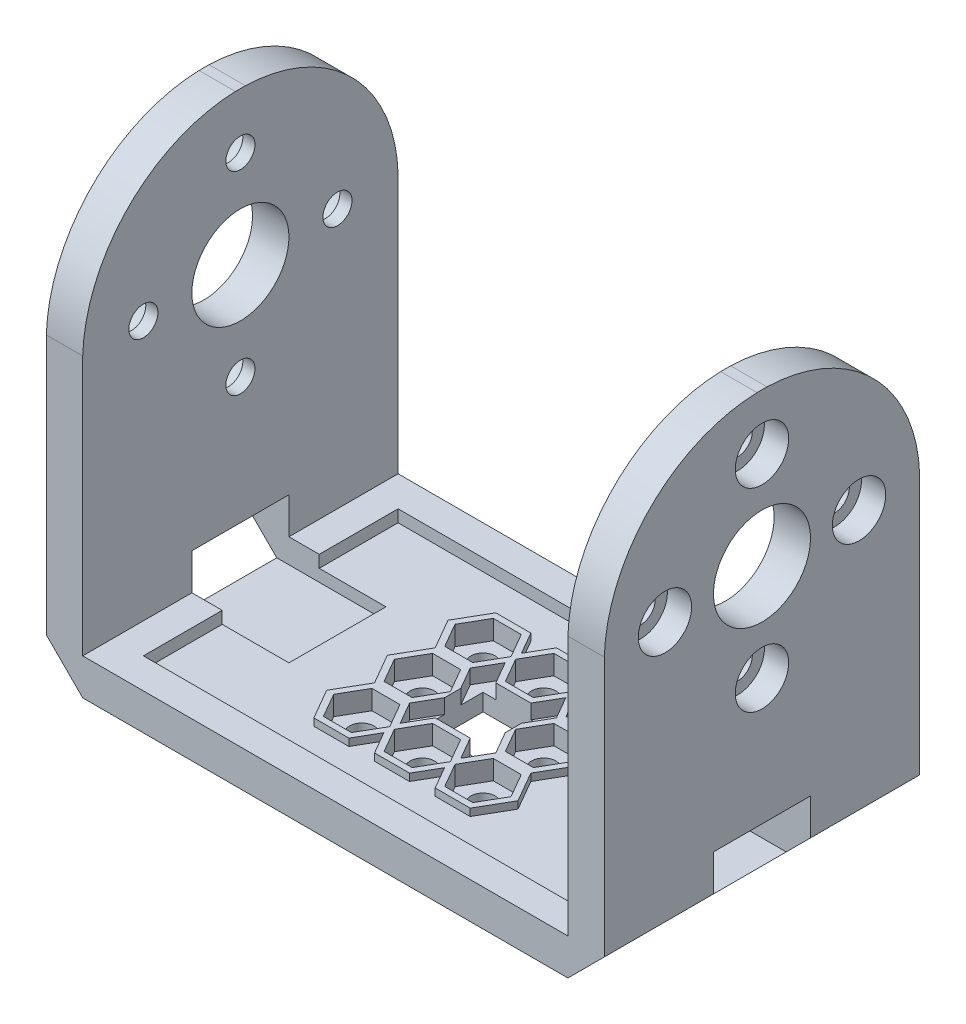
from build123d import *

# Parameters (mm, degrees)
SKETCH_1_W                   = 46
SKETCH_1_H                   = 26
EXTRUDE_1_DEPTH              = 3
SKETCH_2_W                   = 3
SKETCH_2_H                   = 26
EXTRUDE_2_DEPTH              = 34
CUT_EXTRUDE_START            = -46
CUT_EXTRUDE_1_DEPTH          = 46
SKETCH_4_R                   = 4
CUT_EXTRUDE_2_DEPTH          = 61.448325039
HOLE_START                   = -23
HOLE_WIZARD_M2_2_OUTLINE_R   = 2.2
HOLE_WIZARD_M2_2_DEPTH       = 2
HOLE_START_2                 = -21
HOLE_WIZARD_M2_2_2_OUTLINE_R = 1.2
HOLE_WIZARD_M2_2_2_DEPTH     = 1
SKETCH_9_W                   = 35
SKETCH_9_H                   = 21
CUT_EXTRUDE_3_DEPTH          = 1
CHAMFER_1_SIZE               = 3
EXTRUDE_2_2_DEPTH            = 0.6
CUT_EXTRUDE_START_2          = -1
CUT_EXTRUDE_4_DEPTH          = 1.6
SKETCH_11_R                  = 1
CUT_EXTRUDE_5_DEPTH          = 45.654227124
SKETCH_12_W                  = 5
SKETCH_12_H                  = 5
CUT_EXTRUDE_6_DEPTH          = 2.5
CUT_EXTRUDE_7_DEPTH          = 0.6
SKETCH_15_W                  = 8
SKETCH_15_H                  = 5
CUT_EXTRUDE_8_DEPTH          = 11


# Read off the part's stored shape, not the designer's step: 切除-拉伸1, M2 凹头盖螺钉的柱形沉头孔2
with BuildPart() as part:
    # 草图1 → 凸台-拉伸1 (new body)
    with BuildSketch(Plane(origin=(0, 0, 0), x_dir=(1, 0, 0), z_dir=(0, 1, 0))):
        Rectangle(SKETCH_1_W, SKETCH_1_H)
    extrude(amount=EXTRUDE_1_DEPTH)

    # 草图2 → Extrude 2 (add)
    with BuildSketch(Plane(origin=(0, 3, 0), x_dir=(1, 0, 0), z_dir=(0, 1, 0))):
        with Locations((-21.5, 0)):
            Rectangle(SKETCH_2_W, SKETCH_2_H)
        with Locations((21.5, 0)):
            Rectangle(SKETCH_2_W, SKETCH_2_H)
    extrude(amount=EXTRUDE_2_DEPTH)

    # 切除-拉伸1 outline → 切除-拉伸1 (cut)
    with BuildSketch(Plane.ZY.offset(23).offset(CUT_EXTRUDE_START)):
        with BuildLine():
            Line((13, 37), (0.412804961, 37))
            ThreePointArc((0.412804961, 37), (9.197021473, 33.197021473), (13, 24.412804961))
            Line((13, 24.412804961), (13, 37))
        make_face()
        with BuildLine():
            ThreePointArc((-13, 24.412804961), (-9.197021473, 33.197021473), (-0.412804961, 37))
            Line((-0.412804961, 37), (-13, 37))
            Line((-13, 37), (-13, 24.412804961))
        make_face()
    extrude(amount=CUT_EXTRUDE_1_DEPTH, mode=Mode.SUBTRACT)

    # 草图4 → 切除-拉伸2 (cut, through all)
    with BuildSketch(Plane.ZY.offset(23)):
        with Locations((0, 24.412804961)):
            Circle(SKETCH_4_R)
    extrude(amount=-CUT_EXTRUDE_2_DEPTH, mode=Mode.SUBTRACT)

    # M2 凹头盖螺钉的柱形沉头孔2 outline → M2 凹头盖螺钉的柱形沉头孔2 (cut)
    with BuildSketch(Plane.YZ.offset(HOLE_START)):
        with Locations((16.412804961, 0)):
            Circle(HOLE_WIZARD_M2_2_OUTLINE_R)
        with Locations((24.412804961, 8)):
            Circle(HOLE_WIZARD_M2_2_OUTLINE_R)
        with Locations((24.412804961, -8)):
            Circle(HOLE_WIZARD_M2_2_OUTLINE_R)
        with Locations((32.412804961, 0)):
            Circle(HOLE_WIZARD_M2_2_OUTLINE_R)
    hole_wizard_m2_2 = extrude(amount=HOLE_WIZARD_M2_2_DEPTH, mode=Mode.SUBTRACT)

    # Hole Wizard M2 _2 2 outline → Hole Wizard M2 _2 2 (cut)
    with BuildSketch(Plane.YZ.offset(HOLE_START_2)):
        with Locations((16.412804961, 0)):
            Circle(HOLE_WIZARD_M2_2_2_OUTLINE_R)
        with Locations((24.412804961, 8)):
            Circle(HOLE_WIZARD_M2_2_2_OUTLINE_R)
        with Locations((24.412804961, -8)):
            Circle(HOLE_WIZARD_M2_2_2_OUTLINE_R)
        with Locations((32.412804961, 0)):
            Circle(HOLE_WIZARD_M2_2_2_OUTLINE_R)
    hole_wizard_m2_2_2 = extrude(amount=HOLE_WIZARD_M2_2_2_DEPTH, mode=Mode.SUBTRACT)

    # 镜向2: M2 凹头盖螺钉的柱形沉头孔2, Hole Wizard M2 _2 2 across plane
    add(hole_wizard_m2_2.mirror(Plane(origin=(0, 0, 0), x_dir=(0, 0, 1), z_dir=(1, 0, 0))), mode=Mode.SUBTRACT)
    add(hole_wizard_m2_2_2.mirror(Plane(origin=(0, 0, 0), x_dir=(0, 0, 1), z_dir=(1, 0, 0))), mode=Mode.SUBTRACT)

    # 草图9 → 切除-拉伸3 (cut)
    with BuildSketch(Plane(origin=(0, 3, 0), x_dir=(1, 0, 0), z_dir=(0, 1, 0))):
        Rectangle(SKETCH_9_W, SKETCH_9_H)
    extrude(amount=-CUT_EXTRUDE_3_DEPTH, mode=Mode.SUBTRACT)

    # 倒角1
    chamfer_1_edges = [part.edges().sort_by_distance(p)[0] for p in [
        (-23, 0, 0),
        (23, 0, 0),
    ]]
    chamfer(chamfer_1_edges, length=CHAMFER_1_SIZE)

    # 草图10<6> → Extrude 2 2 (add)
    # profile 1 of 9: a face of its own
    with BuildSketch(Plane(origin=(0, 2, 0), x_dir=(1, 0, 0), z_dir=(0, 1, 0))):
        Polygon((3.556624327, -2.5), (6.443375673, -2.5), (7.886751346, 0), (6.443375673, 2.5), (3.556624327, 2.5), (2.113248654, 0), align=None)
        Polygon((3.845299462, -2), (6.154700538, -2), (7.309401077, 0), (6.154700538, 2), (3.845299462, 2), (2.690598923, 0), align=None, mode=Mode.SUBTRACT)
    # profile 2 of 9: a face of its own
    with BuildSketch(Plane(origin=(0, 2, 0), x_dir=(1, 0, 0), z_dir=(0, 1, 0))):
        Polygon((2.886751346, 0), (1.443375673, 2.5), (-1.443375673, 2.5), (-2.886751346, 0), (-1.443375673, -2.5), (1.443375673, -2.5), align=None)
        Polygon((2.309401077, 0), (1.154700538, 2), (-1.154700538, 2), (-2.309401077, 0), (-1.154700538, -2), (1.154700538, -2), align=None, mode=Mode.SUBTRACT)
    # profile 3 of 9: a face of its own
    with BuildSketch(Plane(origin=(0, 2, 0), x_dir=(1, 0, 0), z_dir=(0, 1, 0))):
        Polygon((3.556624327, 2.5), (6.443375673, 2.5), (7.886751346, 5), (6.443375673, 7.5), (3.556624327, 7.5), (2.113248654, 5), align=None)
        Polygon((3.845299462, 3), (6.154700538, 3), (7.309401077, 5), (6.154700538, 7), (3.845299462, 7), (2.690598923, 5), align=None, mode=Mode.SUBTRACT)
    # profile 4 of 9: a face of its own
    with BuildSketch(Plane(origin=(0, 2, 0), x_dir=(1, 0, 0), z_dir=(0, 1, 0))):
        Polygon((-1.443375673, 2.5), (1.443375673, 2.5), (2.886751346, 5), (1.443375673, 7.5), (-1.443375673, 7.5), (-2.886751346, 5), align=None)
        Polygon((-1.154700538, 3), (1.154700538, 3), (2.309401077, 5), (1.154700538, 7), (-1.154700538, 7), (-2.309401077, 5), align=None, mode=Mode.SUBTRACT)
    # profile 5 of 9: a face of its own
    with BuildSketch(Plane(origin=(0, 2, 0), x_dir=(1, 0, 0), z_dir=(0, 1, 0))):
        Polygon((-6.443375673, -2.5), (-3.556624327, -2.5), (-2.113248654, 0), (-3.556624327, 2.5), (-6.443375673, 2.5), (-7.886751346, 0), align=None)
        Polygon((-6.154700538, -2), (-3.845299462, -2), (-2.690598923, 0), (-3.845299462, 2), (-6.154700538, 2), (-7.309401077, 0), align=None, mode=Mode.SUBTRACT)
    # profile 6 of 9: a face of its own
    with BuildSketch(Plane(origin=(0, 2, 0), x_dir=(1, 0, 0), z_dir=(0, 1, 0))):
        Polygon((-6.443375673, -7.5), (-3.556624327, -7.5), (-2.113248654, -5), (-3.556624327, -2.5), (-6.443375673, -2.5), (-7.886751346, -5), align=None)
        Polygon((-6.154700538, -7), (-3.845299462, -7), (-2.690598923, -5), (-3.845299462, -3), (-6.154700538, -3), (-7.309401077, -5), align=None, mode=Mode.SUBTRACT)
    # profile 7 of 9: a face of its own
    with BuildSketch(Plane(origin=(0, 2, 0), x_dir=(1, 0, 0), z_dir=(0, 1, 0))):
        Polygon((-1.443375673, -7.5), (1.443375673, -7.5), (2.886751346, -5), (1.443375673, -2.5), (-1.443375673, -2.5), (-2.886751346, -5), align=None)
        Polygon((-1.154700538, -7), (1.154700538, -7), (2.309401077, -5), (1.154700538, -3), (-1.154700538, -3), (-2.309401077, -5), align=None, mode=Mode.SUBTRACT)
    # profile 8 of 9: a face of its own
    with BuildSketch(Plane(origin=(0, 2, 0), x_dir=(1, 0, 0), z_dir=(0, 1, 0))):
        Polygon((7.886751346, -5), (6.443375673, -2.5), (3.556624327, -2.5), (2.113248654, -5), (3.556624327, -7.5), (6.443375673, -7.5), align=None)
        Polygon((7.309401077, -5), (6.154700538, -3), (3.845299462, -3), (2.690598923, -5), (3.845299462, -7), (6.154700538, -7), align=None, mode=Mode.SUBTRACT)
    # profile 9 of 9: a face of its own
    with BuildSketch(Plane(origin=(0, 2, 0), x_dir=(1, 0, 0), z_dir=(0, 1, 0))):
        Polygon((-3.556624327, 7.5), (-6.443375673, 7.5), (-7.886751346, 5), (-6.443375673, 2.5), (-3.556624327, 2.5), (-2.113248654, 5), align=None)
        Polygon((-3.845299462, 7), (-6.154700538, 7), (-7.309401077, 5), (-6.154700538, 3), (-3.845299462, 3), (-2.690598923, 5), align=None, mode=Mode.SUBTRACT)
    extrude(amount=EXTRUDE_2_2_DEPTH)

    # 草图10 → 切除-拉伸4 (cut)
    with BuildSketch(Plane(origin=(0, 2, 0), x_dir=(1, 0, 0), z_dir=(0, 1, 0)).offset(CUT_EXTRUDE_START_2)):
        Polygon((3.845299462, 2), (2.690598923, 0), (3.845299462, -2), (6.154700538, -2), (7.309401077, 0), (6.154700538, 2), align=None)
        Polygon((2.309401077, 0), (1.154700538, 2), (-1.154700538, 2), (-2.309401077, 0), (-1.154700538, -2), (1.154700538, -2), align=None)
        Polygon((3.845299462, 7), (2.690598923, 5), (3.845299462, 3), (6.154700538, 3), (7.309401077, 5), (6.154700538, 7), align=None)
        Polygon((-1.154700538, 7), (-2.309401077, 5), (-1.154700538, 3), (1.154700538, 3), (2.309401077, 5), (1.154700538, 7), align=None)
        Polygon((-6.154700538, 2), (-7.309401077, 0), (-6.154700538, -2), (-3.845299462, -2), (-2.690598923, 0), (-3.845299462, 2), align=None)
        Polygon((-6.154700538, -3), (-7.309401077, -5), (-6.154700538, -7), (-3.845299462, -7), (-2.690598923, -5), (-3.845299462, -3), align=None)
        Polygon((-1.154700538, -3), (-2.309401077, -5), (-1.154700538, -7), (1.154700538, -7), (2.309401077, -5), (1.154700538, -3), align=None)
        Polygon((3.845299462, -7), (6.154700538, -7), (7.309401077, -5), (6.154700538, -3), (3.845299462, -3), (2.690598923, -5), align=None)
        Polygon((-3.845299462, 7), (-6.154700538, 7), (-7.309401077, 5), (-6.154700538, 3), (-3.845299462, 3), (-2.690598923, 5), align=None)
    extrude(amount=CUT_EXTRUDE_4_DEPTH, mode=Mode.SUBTRACT)

    # 草图11 → 切除-拉伸5 (cut, through all)
    with BuildSketch(Plane(origin=(0, 1, 0), x_dir=(1, 0, 0), z_dir=(0, 1, 0))):
        with Locations(Location((-5, 5, 0), (0, 0, 270))):
            Circle(SKETCH_11_R)
        with Locations(Location((0, 5, 0), (0, 0, 270))):
            Circle(SKETCH_11_R)
        with Locations(Location((5, 5, 0), (0, 0, 270))):
            Circle(SKETCH_11_R)
        with Locations(Location((0, 0, 0), (0, 0, 270))):
            Circle(SKETCH_11_R)
        with Locations(Location((5, 0, 0), (0, 0, 270))):
            Circle(SKETCH_11_R)
        with Locations(Location((0, -5, 0), (0, 0, 270))):
            Circle(SKETCH_11_R)
        with Locations(Location((5, -5, 0), (0, 0, 270))):
            Circle(SKETCH_11_R)
        with Locations(Location((-5, 0, 0), (0, 0, 270))):
            Circle(SKETCH_11_R)
        with Locations(Location((-5, -5, 0), (0, 0, 270))):
            Circle(SKETCH_11_R)
    extrude(amount=-CUT_EXTRUDE_5_DEPTH, mode=Mode.SUBTRACT)

    # 草图12 → 切除-拉伸6 (cut, symmetric)
    with BuildSketch(Plane(origin=(0, 2, 0), x_dir=(1, 0, 0), z_dir=(0, 1, 0))):
        Rectangle(SKETCH_12_W, SKETCH_12_H)
    extrude(amount=CUT_EXTRUDE_6_DEPTH, both=True, mode=Mode.SUBTRACT)

    # 草图14 → 切除-拉伸7 (cut)
    with BuildSketch(Plane(origin=(0, 2, 0), x_dir=(1, 0, 0), z_dir=(0, 1, 0))):
        Polygon((-2.5, 0.669872981), (-1.443375673, 2.5), (-2.5, 4.330127019), (-3.556624327, 2.5), align=None)
        Polygon((2.5, 4.330127019), (1.443375673, 2.5), (2.5, 0.669872981), (3.556624327, 2.5), align=None)
        Polygon((-1.443375673, -2.5), (-2.5, -0.669872981), (-3.556624327, -2.5), (-2.5, -4.330127019), align=None)
        Polygon((3.556624327, -2.5), (2.5, -0.669872981), (1.443375673, -2.5), (2.5, -4.330127019), align=None)
    extrude(amount=-CUT_EXTRUDE_7_DEPTH, mode=Mode.SUBTRACT)

    # 草图15 → 切除-拉伸8 (cut)
    with BuildSketch(Plane(origin=(23, 0, 0), x_dir=(0, 0, -1), z_dir=(1, 0, 0))):
        with Locations((0, 3.5)):
            Rectangle(SKETCH_15_W, SKETCH_15_H)
    cut_extrude_8 = extrude(amount=-CUT_EXTRUDE_8_DEPTH, mode=Mode.SUBTRACT)

    # 镜向3: 切除-拉伸8 across plane
    add(cut_extrude_8.mirror(Plane(origin=(0, 0, 0), x_dir=(0, 0, 1), z_dir=(1, 0, 0))), mode=Mode.SUBTRACT)


solid = part.part
